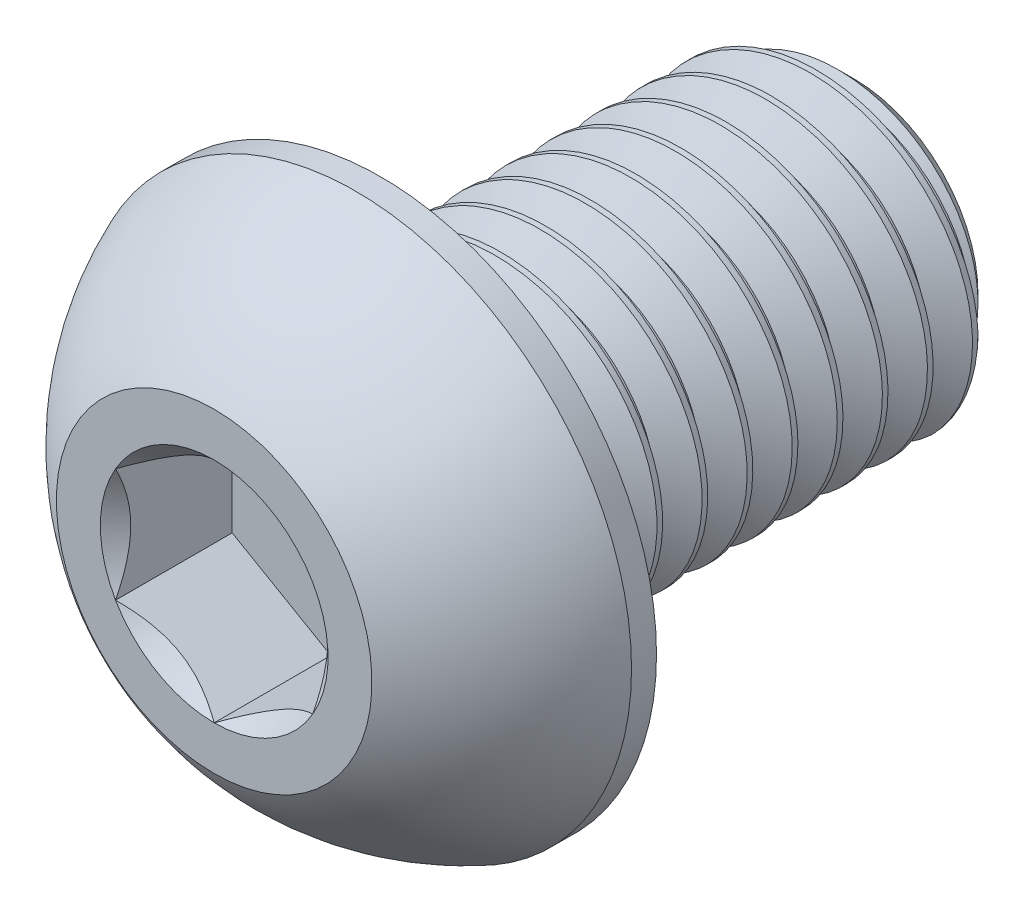
from build123d import *

# Parameters (mm, degrees)
SKETCH1_W          = 9.525
SKETCH1_H          = 3.175
CHAMFER1_SIZE      = 0.680357143
CUT_SWEEP1_PITCH   = 0.907142857
CUT_EXTRUDE2_DEPTH = 2.34696


with BuildPart() as part:
    # Sketch1 → Revolve1 (revolve)
    with BuildSketch(Plane(origin=(0, 0, 0), x_dir=(0, 0, -1), z_dir=(1, 0, 0))):
        with Locations((8.1153, 1.5875)):
            Rectangle(SKETCH1_W, SKETCH1_H)
    revolve(axis=Axis((0, 0, -12.8778), (0, 0, 1)))

    # Chamfer1
    chamfer1_edges = [part.edges().sort_by_distance(p)[0] for p in [
        (0, -3.175, -12.8778),
    ]]
    chamfer(chamfer1_edges, length=CHAMFER1_SIZE)

    # Cut-Sweep1: the profile of Sketch2 profile screwed along a right-hand helix of 11.5 turns, 8 arcs to a turn; built about Z, then put on its axis
    cut_sweep1_z = Axis((0, 0, 0), (0, 0, 1))
    cut_sweep1_corners = [(3.1753, 0, 0.000173205), (3.1753, 0, -0.793923205), (2.585793431, 0, -0.453571429), (2.585793431, 0, -0.340178571)]
    with BuildLine(mode=Mode.PRIVATE) as cut_sweep1_profile:
        Line(cut_sweep1_corners[0], cut_sweep1_corners[1])
        Line(cut_sweep1_corners[1], cut_sweep1_corners[2])
        Line(cut_sweep1_corners[2], cut_sweep1_corners[3])
        Line(cut_sweep1_corners[3], cut_sweep1_corners[0])
    cut_sweep1_cap = Face(cut_sweep1_profile.wire())
    cut_sweep1_turn_angles = [0, 22.5, 45, 67.5, 90, 112.5, 135, 157.5, 180, 202.5, 225, 247.5, 270, 292.5, 315, 337.5, 360]
    cut_sweep1_turn_weights = [1, 0.9238795325112867, 1, 0.9238795325112867, 1, 0.9238795325112867, 1, 0.9238795325112867, 1, 0.9238795325112867, 1, 0.9238795325112867, 1, 0.9238795325112867, 1, 0.9238795325112867, 1]
    cut_sweep1_turn_rails = [Edge.make_bspline([Vector(p[0], p[1], 0).rotate(cut_sweep1_z, cut_sweep1_turn_angles[k]) / cut_sweep1_turn_weights[k] + Vector(0, 0, p[2] + CUT_SWEEP1_PITCH * cut_sweep1_turn_angles[k] / 360) for k in range(17)], [0, 0, 0, 1, 1, 2, 2, 3, 3, 4, 4, 5, 5, 6, 6, 7, 7, 8, 8, 8], 2, cut_sweep1_turn_weights) for p in cut_sweep1_corners]
    cut_sweep1_turn_sides = [Face.make_surface_from_curves(cut_sweep1_turn_rails[p[0]], cut_sweep1_turn_rails[p[1]]) for p in [(0, 1), (1, 2), (2, 3), (3, 0)]]
    cut_sweep1_last_angles = [3960, 3982.5, 4005, 4027.5, 4050, 4072.5, 4095, 4117.5, 4140]
    cut_sweep1_last_weights = [1, 0.9238795325112867, 1, 0.9238795325112867, 1, 0.9238795325112867, 1, 0.9238795325112776, 1]
    cut_sweep1_last_rails = [Edge.make_bspline([Vector(p[0], p[1], 0).rotate(cut_sweep1_z, cut_sweep1_last_angles[k]) / cut_sweep1_last_weights[k] + Vector(0, 0, p[2] + CUT_SWEEP1_PITCH * cut_sweep1_last_angles[k] / 360) for k in range(9)], [0, 0, 0, 1, 1, 2, 2, 3, 3, 4, 4, 4], 2, cut_sweep1_last_weights) for p in cut_sweep1_corners]
    cut_sweep1_last_sides = [Face.make_surface_from_curves(cut_sweep1_last_rails[p[0]], cut_sweep1_last_rails[p[1]]) for p in [(0, 1), (1, 2), (2, 3), (3, 0)]]
    cut_sweep1 = Plane(origin=(0, 0, -12.8778), x_dir=(0, 1, 0), z_dir=(0, 0, 1)) * Solid(Shell([*[p.moved(Location((0, 0, CUT_SWEEP1_PITCH * i))) for i in range(11) for p in cut_sweep1_turn_sides], *cut_sweep1_last_sides, cut_sweep1_cap, cut_sweep1_cap.rotate(cut_sweep1_z, 4140).moved(Location((0, 0, CUT_SWEEP1_PITCH * 4140 / 360)))]))
    add(cut_sweep1, mode=Mode.SUBTRACT)

    # Sketch7 → Revolve2 (revolve)
    with BuildSketch(Plane(origin=(0, 0, 0), x_dir=(0, 0, -1), z_dir=(1, 0, 0)), mode=Mode.PRIVATE) as revolve2_sk:
        with BuildLine():
            Line((2.84988, 5.5499), (3.3528, 5.5499))
            Line((3.3528, 5.5499), (3.3528, 0))
            Line((3.3528, 0), (0, 0))
            Line((0, 0), (0, 3.175))
            ThreePointArc((0, 3.175), (1.235921075, 4.58927271), (2.84988, 5.5499))
        make_face()
    revolve(revolve2_sk.sketch.rotate(Axis((0, 0, 0), (0, 0, -1)), 189.052465709), axis=Axis((0, 0, 0), (0, 0, -1)))

    # Sketch5 → Cut-Extrude2 (cut)
    with BuildSketch(Plane.XY):
        Polygon((1.984375, -1.14567944), (1.984375, 1.14567944), (0, 2.291358881), (-1.984375, 1.14567944), (-1.984375, -1.14567944), (0, -2.291358881), align=None)
    extrude(amount=-CUT_EXTRUDE2_DEPTH, mode=Mode.SUBTRACT)

    # Cut-Extrude3 cone 1 section (through the dimple's axis) → Cut-Extrude3 (revolve, cut)
    with BuildSketch(Plane(origin=(0, 0, 0), x_dir=(0, -1, 0), z_dir=(1, 0, 0))):
        Polygon((0, 0), (2.291358881, 0), (0, 2.291358881), align=None)
    revolve(axis=Axis((0, 0, 0), (0, 0, -1)), mode=Mode.SUBTRACT)


solid = part.part
